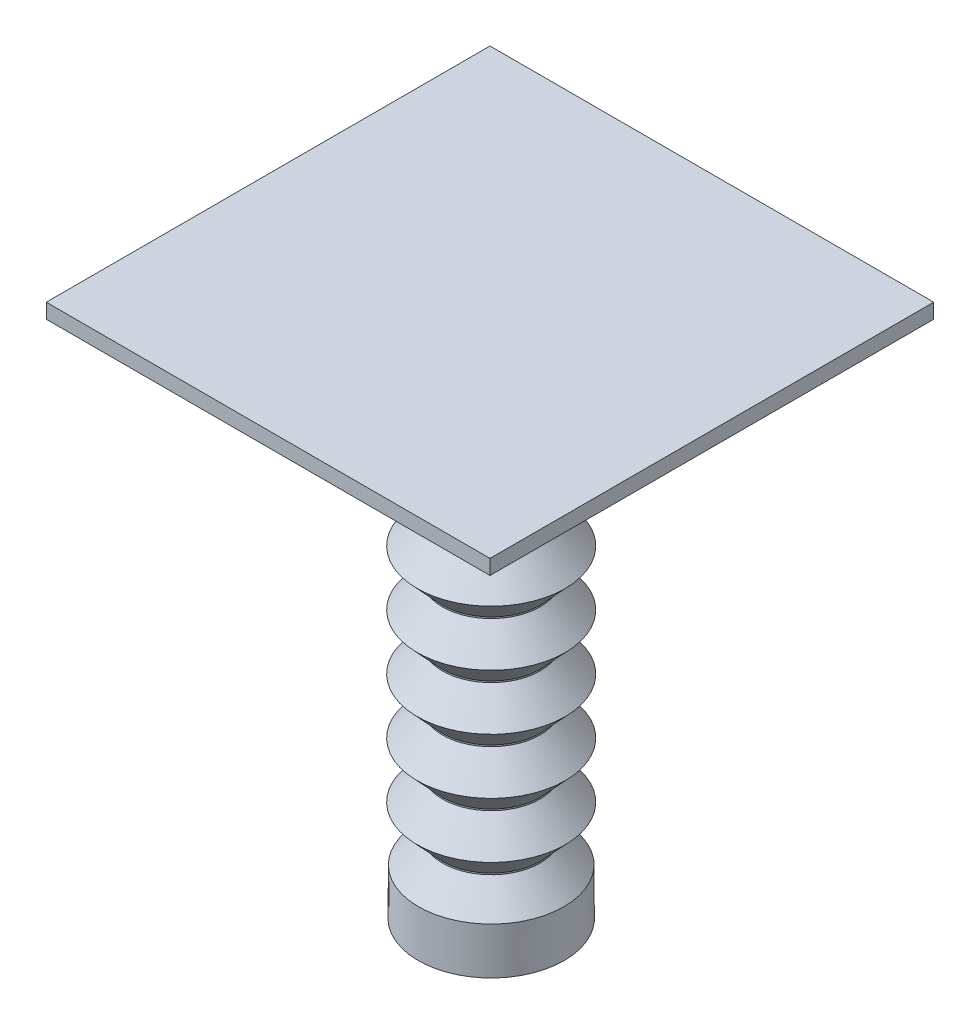
from build123d import *

# Parameters (mm, degrees)
SKETCH7_W                   = 30
SKETCH7_H                   = 30
THICKEN5_T2                 = 1
BODY_MOVE_COPY5_START       = 35.102954004
BODY_MOVE_COPY5_OUTLINE_W   = 30
BODY_MOVE_COPY5_OUTLINE_H   = 30
BODY_MOVE_COPY5_DEPTH       = 0.011205152
BODY_MOVE_COPY5_START_2     = 34.102954004
BODY_MOVE_COPY5_2_OUTLINE_W = 30
BODY_MOVE_COPY5_2_OUTLINE_H = 30
BODY_MOVE_COPY5_2_DEPTH     = 0.011205152


# Read off the part's stored shape, not the designer's step: Thicken1, Body-Move/Copy5
with BuildPart() as part:
    # Thicken1 outline → Thicken1 (revolve)
    with BuildSketch(Plane(origin=(-5.431630681, 0, 0), x_dir=(1, 0, 0), z_dir=(0, 0, 1))):
        Polygon((4.120349674, 1.929400611), (4.136521177, -0.904564978), (4.936508153, -0.9), (4.918558927, 2.245501685), (3.3, 3.988409531), (3.3, 4.088409531), (5, 5.913409531), (3.3, 7.738409531), (3.3, 7.838409531), (5, 9.663409531), (3.3, 11.488409531), (3.3, 11.588409531), (5, 13.413409531), (3.3, 15.238409531), (3.3, 15.338409531), (5, 17.163409531), (3.3, 18.988409531), (3.3, 19.088409531), (5, 20.913409531), (3.3, 22.738409531), (3.3, 22.838409531), (5, 24.663409531), (3.3, 26.488409531), (3.3, 26.588409531), (5, 28.413409531), (3.3, 30.238409531), (3.3, 30.338409531), (5, 32.163409531), (3.3, 33.988409531), (3.3, 34.102954004), (0, 34.102954004), (0, 33.302954004), (2.845194483, 33.302954004), (3.906687965, 32.163409531), (2.5, 30.653288628), (2.5, 29.923530434), (3.906687965, 28.413409531), (2.5, 26.903288628), (2.5, 26.173530434), (3.906687965, 24.663409531), (2.5, 23.153288628), (2.5, 22.423530434), (3.906687965, 20.913409531), (2.5, 19.403288628), (2.5, 18.673530434), (3.906687965, 17.163409531), (2.5, 15.653288628), (2.5, 14.923530434), (3.906687965, 13.413409531), (2.5, 11.903288628), (2.5, 11.173530434), (3.906687965, 9.663409531), (2.5, 8.153288628), (2.5, 7.423530434), (3.906687965, 5.913409531), (2.5, 4.403288628), (2.5, 3.674236782), align=None)
    revolve(axis=Axis((-5.431630681, 0, 0), (0, 1, 0)))


with BuildPart() as body_2:
    # Sketch7 → Surface-Plane3: a flat surface bounded by the sketch
    with BuildSketch(Plane(origin=(0, 0, 0), x_dir=(1, 0, 0), z_dir=(0, 1, 0)), mode=Mode.PRIVATE) as surface_plane3_1_region:
        with Locations((44.749783052, 15)):
            Rectangle(SKETCH7_W, SKETCH7_H)
    surface_plane3_1 = surface_plane3_1_region.sketch.faces()[0]
    add(Solid.thicken(surface_plane3_1, -THICKEN5_T2))


with BuildPart() as body_2_1:
    # Body-Move/Copy3: moved
    add(body_2.part.moved(Location((-50.300030874, 35.114159156, 14.96319027))))

    # Body-Move/Copy5 outline → Body-Move/Copy5 (cut)
    with BuildSketch(Plane(origin=(0, 0, 0), x_dir=(1, 0, 0), z_dir=(0, 1, 0)).offset(BODY_MOVE_COPY5_START)):
        with Locations((-5.550247822, 0.03680973)):
            Rectangle(BODY_MOVE_COPY5_OUTLINE_W, BODY_MOVE_COPY5_OUTLINE_H)
    extrude(amount=BODY_MOVE_COPY5_DEPTH, mode=Mode.SUBTRACT)

    # Body-Move_Copy5 2 outline → Body-Move_Copy5 2 (add)
    with BuildSketch(Plane(origin=(0, 0, 0), x_dir=(1, 0, 0), z_dir=(0, 1, 0)).offset(BODY_MOVE_COPY5_START_2)):
        with Locations((-5.550247822, 0.03680973)):
            Rectangle(BODY_MOVE_COPY5_2_OUTLINE_W, BODY_MOVE_COPY5_2_OUTLINE_H)
    extrude(amount=BODY_MOVE_COPY5_2_DEPTH)

    # Combine1: union part
    add(part.part)


solid = body_2_1.part
